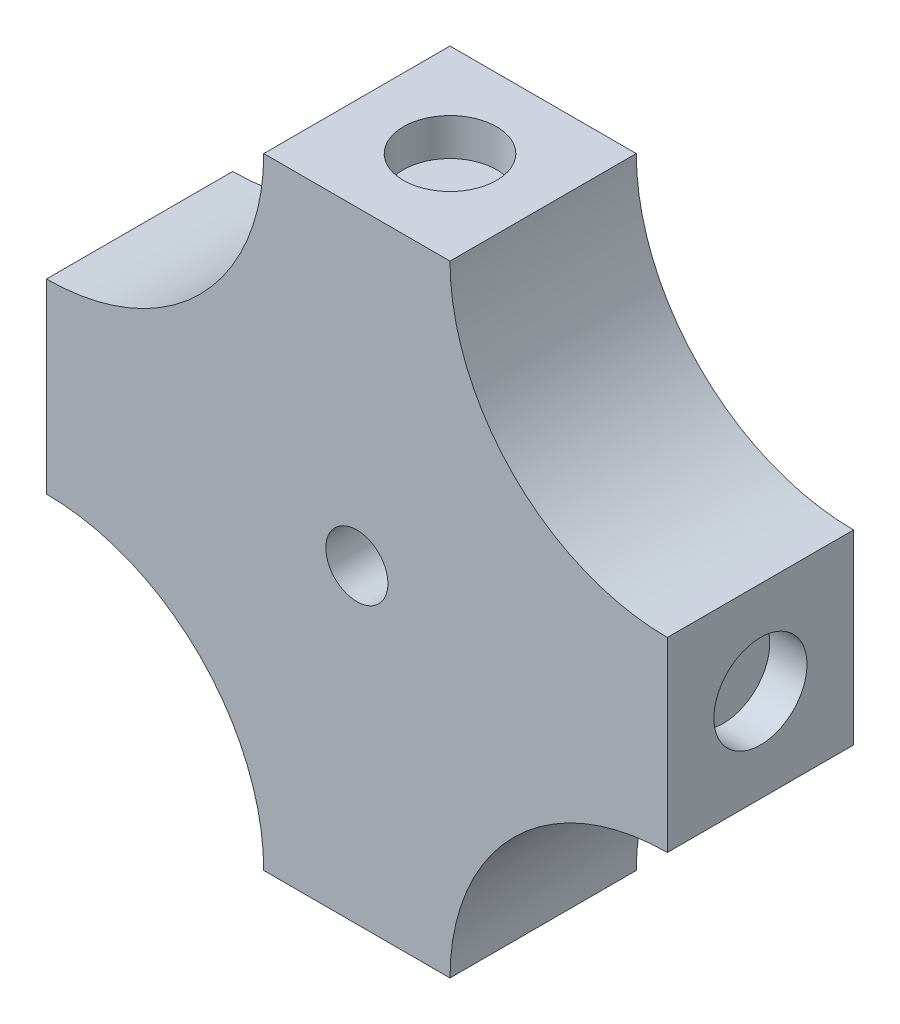
from build123d import *

# Parameters (mm, degrees)
SKETCH10_W          = 7
SKETCH10_H          = 6
SKETCH10_W_2        = 6
SKETCH10_H_2        = 7
BOSS_EXTRUDE4_DEPTH = 6
SKETCH11_R          = 1.5
CUT_EXTRUDE3_DEPTH  = 1.2
SKETCH14_R          = 1.5
CUT_EXTRUDE4_DEPTH  = 1.2
CUT_EXTRUDE5_START  = -1.2
SKETCH15_R          = 1.5
CUT_EXTRUDE5_DEPTH  = 1.2
CUT_EXTRUDE7_START  = -1.2
SKETCH16_R          = 1.5
CUT_EXTRUDE7_DEPTH  = 1.2
FILLET1_R           = 7
FILLET2_R           = 7
FILLET3_R           = 7
FILLET4_R           = 7
SKETCH17_R          = 1
CUT_EXTRUDE8_DEPTH  = 6


with BuildPart() as part:
    # Sketch10 → Boss-Extrude4 (new body)
    with BuildSketch(Plane.XY):
        with Locations((-272.368433777, 135.088329622)):
            Rectangle(SKETCH10_W, SKETCH10_H)
        with Locations((-265.868433777, 128.588329622)):
            Rectangle(SKETCH10_W_2, SKETCH10_H_2)
        with Locations((-259.368433777, 135.088329622)):
            Rectangle(SKETCH10_W, SKETCH10_H)
        with Locations((-265.868433777, 135.088329622)):
            Rectangle(SKETCH10_W_2, SKETCH10_H)
        with Locations((-265.868433777, 141.588329622)):
            Rectangle(SKETCH10_W_2, SKETCH10_H_2)
    extrude(amount=BOSS_EXTRUDE4_DEPTH)

    # Sketch11 → Cut-Extrude3 (cut)
    with BuildSketch(Plane(origin=(0, 145.088329622, 0), x_dir=(1, 0, 0), z_dir=(0, 1, 0))):
        with Locations(Location((-265.868433777, -3, 0), (0, 0, 270))):
            Circle(SKETCH11_R)
    extrude(amount=-CUT_EXTRUDE3_DEPTH, mode=Mode.SUBTRACT)

    # Sketch14 → Cut-Extrude4 (cut)
    with BuildSketch(Plane.ZY.offset(275.868433777)):
        with Locations((3, 135.088329622)):
            Circle(SKETCH14_R)
    extrude(amount=-CUT_EXTRUDE4_DEPTH, mode=Mode.SUBTRACT)

    # Sketch15 → Cut-Extrude5 (cut)
    with BuildSketch(Plane(origin=(0, 125.088329622, 0), x_dir=(-1, 0, 0), z_dir=(0, -1, 0)).offset(CUT_EXTRUDE5_START)):
        with Locations(Location((265.868433777, -3, 0), (0, 0, 270))):
            Circle(SKETCH15_R)
    extrude(amount=CUT_EXTRUDE5_DEPTH, mode=Mode.SUBTRACT)

    # Sketch16 → Cut-Extrude7 (cut)
    with BuildSketch(Plane(origin=(-255.868433777, 0, 0), x_dir=(0, 0, -1), z_dir=(1, 0, 0)).offset(CUT_EXTRUDE7_START)):
        with Locations(Location((-3, 135.088329622, 0), (0, 0, 180))):
            Circle(SKETCH16_R)
    extrude(amount=CUT_EXTRUDE7_DEPTH, mode=Mode.SUBTRACT)

    # Fillet1
    fillet1_edges = [part.edges().sort_by_distance(p)[0] for p in [
        (-262.868433777, 138.088329622, 3),
    ]]
    fillet(fillet1_edges, radius=FILLET1_R - 0.0001)  # a hair under: the kernel refuses the full size

    # Fillet2
    fillet2_edges = [part.edges().sort_by_distance(p)[0] for p in [
        (-268.868433777, 138.088329622, 3),
    ]]
    fillet(fillet2_edges, radius=FILLET2_R - 0.0001)  # a hair under: the kernel refuses the full size

    # Fillet3
    fillet3_edges = [part.edges().sort_by_distance(p)[0] for p in [
        (-268.868433777, 132.088329622, 3),
    ]]
    fillet(fillet3_edges, radius=FILLET3_R - 0.0001)  # a hair under: the kernel refuses the full size

    # Fillet4
    fillet4_edges = [part.edges().sort_by_distance(p)[0] for p in [
        (-262.868433777, 132.088329622, 3),
    ]]
    fillet(fillet4_edges, radius=FILLET4_R - 0.0001)  # a hair under: the kernel refuses the full size

    # Sketch17 → Cut-Extrude8 (cut)
    with BuildSketch(Plane(origin=(0, 0, 0), x_dir=(-1, 0, 0), z_dir=(0, 0, -1))):
        with Locations((265.868433777, 135.088329622)):
            Circle(SKETCH17_R)
    extrude(amount=-CUT_EXTRUDE8_DEPTH, mode=Mode.SUBTRACT)


solid = part.part
